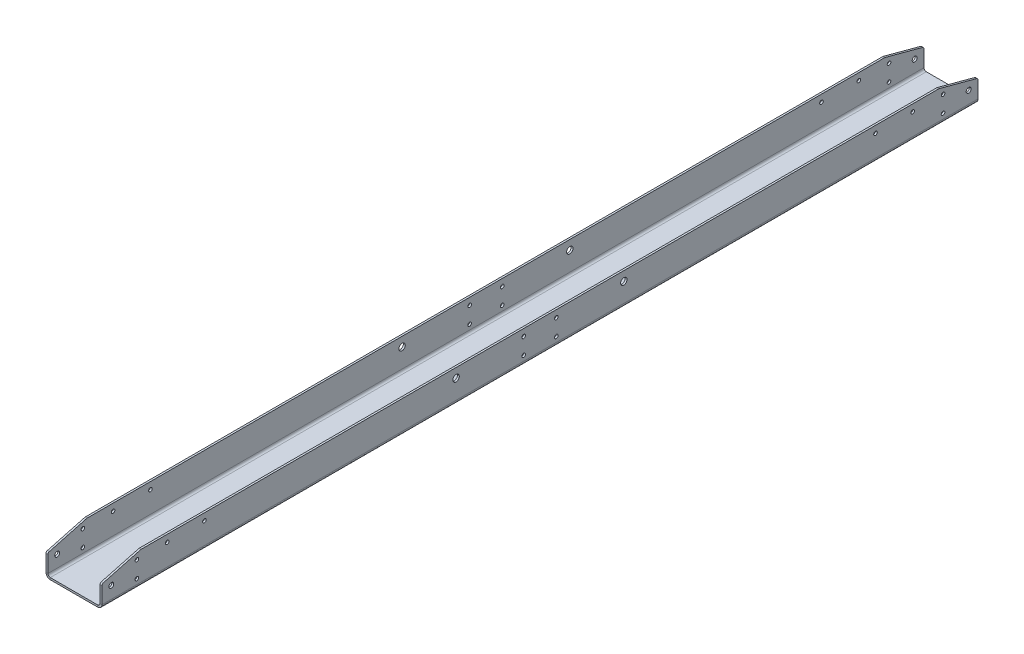
from build123d import *

# Parameters (mm, degrees)
BASE_FLANGE1_DEPTH                        = 1193.8
CUT_EXTRUDE1_DEPTH                        = 1198.055003958
F_1_4_CLEARANCE_HOLE1_D                   = 6.7564
F_10_0_1935_DIAMETER_HOLE1_D              = 4.9149
HOLE_FOR_1_4_SELF_CLINCHING_NUTS_S_SS_C_D = 8.7376
FILLET1_R                                 = 2.54


# Sheet-metal steps are written as plain solids
with BuildPart() as part:
    # Sketch1 → Base-Flange1 (new body)
    with BuildSketch(Plane.XY):
        with BuildLine():
            Line((-38.1, 44.45), (-38.1, 5.76326))
            ThreePointArc((-38.1, 5.76326), (-36.411980228, 1.688019772), (-32.33674, 0))
            Line((-32.33674, 0), (32.33674, 0))
            ThreePointArc((32.33674, 0), (36.411980228, 1.688019772), (38.1, 5.76326))
            Line((38.1, 5.76326), (38.1, 44.45))
            Line((38.1, 44.45), (35.51174, 44.45))
            Line((35.51174, 44.45), (35.51174, 5.76326))
            ThreePointArc((35.51174, 5.76326), (34.58180403, 3.51819597), (32.33674, 2.58826))
            Line((32.33674, 2.58826), (-32.33674, 2.58826))
            ThreePointArc((-32.33674, 2.58826), (-34.58180403, 3.51819597), (-35.51174, 5.76326))
            Line((-35.51174, 5.76326), (-35.51174, 44.45))
            Line((-35.51174, 44.45), (-38.1, 44.45))
        make_face()
    extrude(amount=BASE_FLANGE1_DEPTH)

    # Sketch6 → Cut-Extrude1 (cut, through all)
    with BuildSketch(Plane(origin=(38.1, 0, 0), x_dir=(0, 0, -1), z_dir=(1, 0, 0))):
        Polygon((-1140.478324087, 44.45), (-1193.8, 30.1625), (-1193.8, 44.45), align=None)
        Polygon((0, 44.45), (-53.321675913, 44.45), (0, 30.1625), align=None)
    extrude(amount=-CUT_EXTRUDE1_DEPTH, mode=Mode.SUBTRACT)

    # 1/4 Clearance Hole1 (through all)
    with Locations(Plane.ZY.offset(38.1)):
        with Locations((1181.1, 22.225), (12.7, 22.225)):
            Hole(F_1_4_CLEARANCE_HOLE1_D / 2)

    # #10 (0.1935) Diameter Hole1 (through all)
    with Locations(Plane(origin=(38.1, 0, 0), x_dir=(0, 0, -1), z_dir=(1, 0, 0))):
        with Locations((-619.125, 34.925), (-619.125, 12.7), (-574.675, 12.7), (-574.675, 34.925), (-1146.175, 12.7), (-1104.9, 34.925), (-1054.1, 34.925), (-1146.175, 34.925), (-47.625, 34.925), (-139.7, 34.925), (-88.9, 34.925), (-47.625, 12.7)):
            Hole(F_10_0_1935_DIAMETER_HOLE1_D / 2)

    # Hole for 1/4 Self-clinching Nuts (S,SS,CLS,CLSS)1 (through all)
    with Locations(Plane(origin=(38.1, 0, 0), x_dir=(0, 0, -1), z_dir=(1, 0, 0))):
        with Locations((-711.2, 31.75), (-482.6, 31.75)):
            Hole(HOLE_FOR_1_4_SELF_CLINCHING_NUTS_S_SS_C_D / 2)

    # Fillet1
    fillet1_edges = [part.edges().sort_by_distance(p)[0] for p in [
        (36.80587, 30.1625, 1193.8),
        (36.80587, 44.45, 1140.478324087),
        (-36.80587, 30.1625, 0),
        (-36.80587, 44.45, 53.321675913),
        (36.80587, 44.45, 53.321675913),
        (36.80587, 30.1625, 0),
        (-36.80587, 44.45, 1140.478324087),
        (-36.80587, 30.1625, 1193.8),
    ]]
    fillet(fillet1_edges, radius=FILLET1_R)


solid = part.part
